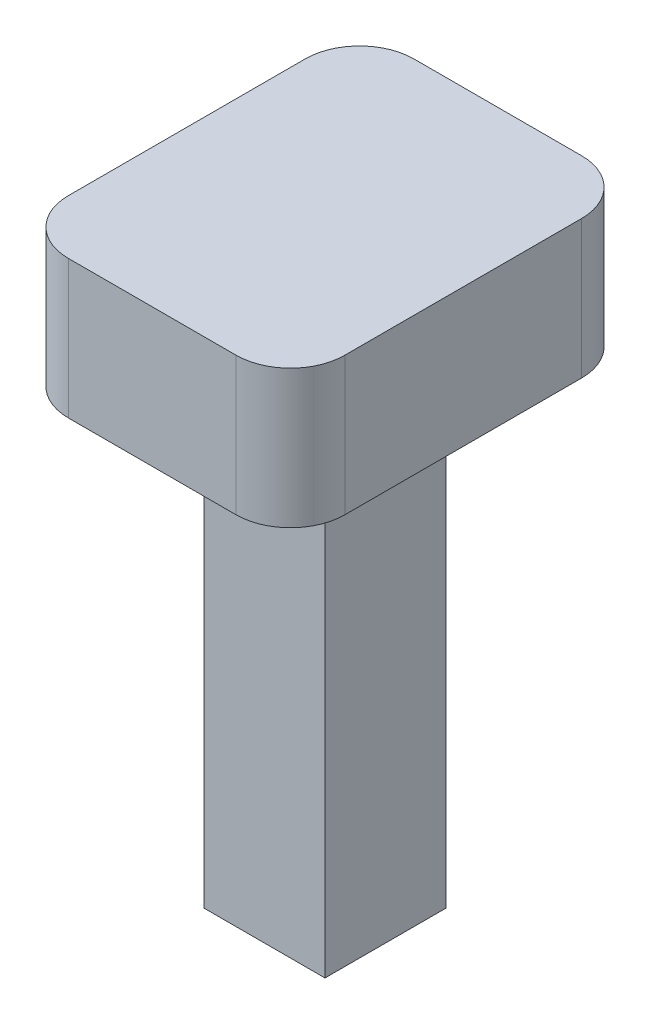
from build123d import *

# Parameters (mm, degrees)
SKETCH1_W           = 2.775
SKETCH1_H           = 2.775
BOSS_EXTRUDE1_DEPTH = 10.775
SKETCH2_W           = 6.35
SKETCH2_H           = 7.9375
BOSS_EXTRUDE2_DEPTH = 3.175
FILLET1_R           = 1.25


with BuildPart() as part:
    # Sketch1 → Boss-Extrude1 (new body)
    with BuildSketch(Plane(origin=(0, 0, 0), x_dir=(1, 0, 0), z_dir=(0, 1, 0))):
        Rectangle(SKETCH1_W, SKETCH1_H)
    extrude(amount=BOSS_EXTRUDE1_DEPTH)

    # Sketch2 → Boss-Extrude2 (add)
    with BuildSketch(Plane(origin=(0, 10.775, 0), x_dir=(1, 0, 0), z_dir=(0, 1, 0))):
        Rectangle(SKETCH2_W, SKETCH2_H)
    extrude(amount=BOSS_EXTRUDE2_DEPTH)

    # Fillet1
    fillet1_edges = [part.edges().sort_by_distance(p)[0] for p in [
        (0, 10.775, -1.3875),
        (1.3875, 10.775, 0),
        (0, 10.775, 1.3875),
        (-1.3875, 10.775, 0),
        (-3.175, 12.3625, -3.96875),
        (3.175, 12.3625, -3.96875),
        (-3.175, 12.3625, 3.96875),
        (3.175, 12.3625, 3.96875),
    ]]
    fillet(fillet1_edges, radius=FILLET1_R)


solid = part.part
